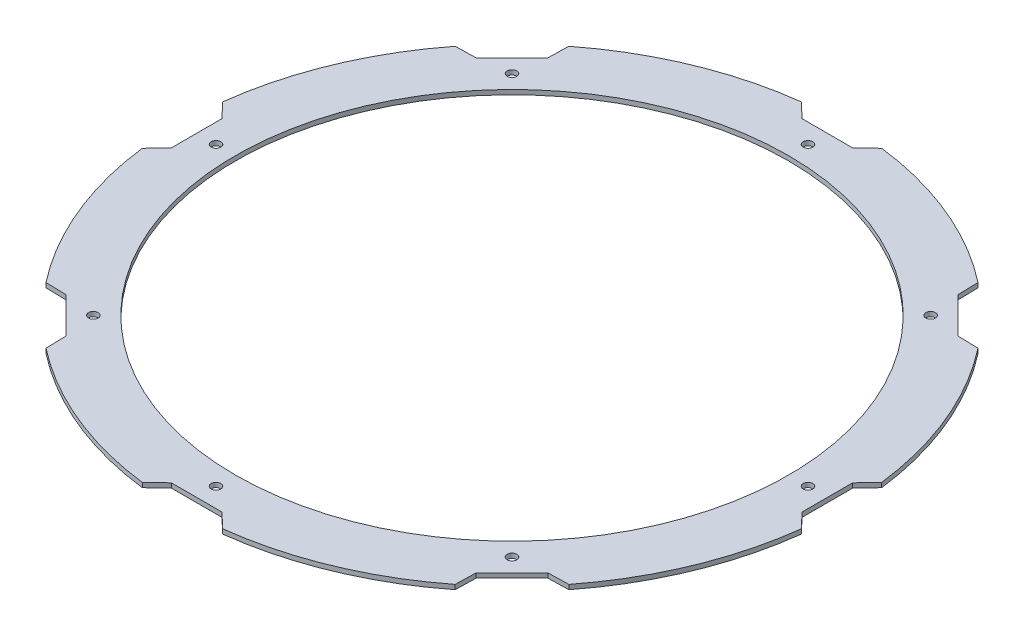
from build123d import *

# Parameters (mm, degrees)
SKETCH1_R           = 3.302
SKETCH1_R_2         = 190.5
BOSS_EXTRUDE1_DEPTH = 3.175
CHAMFER1_DEPTH      = 3.175


with BuildPart() as part:
    # Sketch1 → Boss-Extrude1 (new body)
    with BuildSketch(Plane(origin=(0, 0, 0), x_dir=(1, 0, 0), z_dir=(0, 1, 0))):
        with BuildLine():
            Line((228.003026076, -16.51), (217.17, -16.51))
            Line((217.17, -16.51), (217.17, 16.51))
            Line((217.17, 16.51), (228.003026076, 16.51))
            ThreePointArc((228.003026076, 16.51), (211.198861132, 87.481432639), (172.896818827, 149.548152912))
            Line((172.896818827, 149.548152912), (165.236712628, 141.888046713))
            Line((165.236712628, 141.888046713), (141.888046713, 165.236712628))
            Line((141.888046713, 165.236712628), (149.548152912, 172.896818827))
            ThreePointArc((149.548152912, 172.896818827), (87.481432639, 211.198861132), (16.51, 228.003026076))
            Line((16.51, 228.003026076), (16.51, 217.17))
            Line((16.51, 217.17), (-16.51, 217.17))
            Line((-16.51, 217.17), (-16.51, 228.003026076))
            ThreePointArc((-16.51, 228.003026076), (-87.481432639, 211.198861132), (-149.548152912, 172.896818827))
            Line((-149.548152912, 172.896818827), (-141.888046713, 165.236712628))
            Line((-141.888046713, 165.236712628), (-165.236712628, 141.888046713))
            Line((-165.236712628, 141.888046713), (-172.896818827, 149.548152912))
            ThreePointArc((-172.896818827, 149.548152912), (-211.198861132, 87.481432639), (-228.003026076, 16.51))
            Line((-228.003026076, 16.51), (-217.17, 16.51))
            Line((-217.17, 16.51), (-217.17, -16.51))
            Line((-217.17, -16.51), (-228.003026076, -16.51))
            ThreePointArc((-228.003026076, -16.51), (-211.198861132, -87.481432639), (-172.896818827, -149.548152912))
            Line((-172.896818827, -149.548152912), (-165.236712628, -141.888046713))
            Line((-165.236712628, -141.888046713), (-141.888046713, -165.236712628))
            Line((-141.888046713, -165.236712628), (-149.548152912, -172.896818827))
            ThreePointArc((-149.548152912, -172.896818827), (-87.481432639, -211.198861132), (-16.51, -228.003026076))
            Line((-16.51, -228.003026076), (-16.51, -217.17))
            Line((-16.51, -217.17), (16.51, -217.17))
            Line((16.51, -217.17), (16.51, -228.003026076))
            ThreePointArc((16.51, -228.003026076), (87.481432639, -211.198861132), (149.548152912, -172.896818827))
            Line((149.548152912, -172.896818827), (141.888046713, -165.236712628))
            Line((141.888046713, -165.236712628), (165.236712628, -141.888046713))
            Line((165.236712628, -141.888046713), (172.896818827, -149.548152912))
            ThreePointArc((172.896818827, -149.548152912), (211.198861132, -87.481432639), (228.003026076, -16.51))
        make_face()
        with Locations(Location((-144.133110743, -144.133110743, 0), (0, 0, 270))):
            Circle(SKETCH1_R, mode=Mode.SUBTRACT)
        with Locations(Location((0, -203.835, 0), (0, 0, 270))):
            Circle(SKETCH1_R, mode=Mode.SUBTRACT)
        with Locations(Location((144.133110743, -144.133110743, 0), (0, 0, 270))):
            Circle(SKETCH1_R, mode=Mode.SUBTRACT)
        with Locations(Location((203.835, 0, 0), (0, 0, 270))):
            Circle(SKETCH1_R, mode=Mode.SUBTRACT)
        with Locations(Location((-203.835, 0, 0), (0, 0, 270))):
            Circle(SKETCH1_R, mode=Mode.SUBTRACT)
        with Locations(Location((-144.133110743, 144.133110743, 0), (0, 0, 270))):
            Circle(SKETCH1_R, mode=Mode.SUBTRACT)
        with Locations(Location((0, 0, 0), (0, 0, 270))):
            Circle(SKETCH1_R_2, mode=Mode.SUBTRACT)
        with Locations(Location((0, 203.835, 0), (0, 0, 270))):
            Circle(SKETCH1_R, mode=Mode.SUBTRACT)
        with Locations(Location((144.133110743, 144.133110743, 0), (0, 0, 270))):
            Circle(SKETCH1_R, mode=Mode.SUBTRACT)
    extrude(amount=BOSS_EXTRUDE1_DEPTH)

    # Chamfer1: read off the stored shape, not the designer's step
    # Chamfer1 outline → Chamfer1 (cut)
    with BuildSketch(Plane(origin=(0, 0, 0), x_dir=(1, 0, 0), z_dir=(0, 1, 0))):
        with BuildLine():
            ThreePointArc((228.003026076, 16.51), (227.528537531, 22.1071167), (226.916669439, 27.690885335))
            Line((226.916669439, 27.690885335), (217.17, 17.417305498))
            Line((217.17, 17.417305498), (217.17, 16.51))
            Line((217.17, 16.51), (228.003026076, 16.51))
        make_face()
        with BuildLine():
            Line((165.878274498, 141.246484842), (180.034728522, 140.873902927))
            ThreePointArc((180.034728522, 140.873902927), (176.519063933, 145.254879671), (172.896818827, 149.548152912))
            Line((172.896818827, 149.548152912), (165.236712628, 141.888046713))
            Line((165.236712628, 141.888046713), (165.878274498, 141.246484842))
        make_face()
        with BuildLine():
            Line((228.003026076, -16.51), (217.17, -16.51))
            Line((217.17, -16.51), (217.17, -17.417305498))
            Line((217.17, -17.417305498), (226.916669439, -27.690885335))
            ThreePointArc((226.916669439, -27.690885335), (227.528537531, -22.1071167), (228.003026076, -16.51))
        make_face()
        with BuildLine():
            Line((141.246484842, 165.878274498), (141.888046712, 165.236712627))
            Line((141.888046712, 165.236712627), (149.548152912, 172.896818827))
            ThreePointArc((149.548152912, 172.896818827), (145.254879671, 176.519063933), (140.873902927, 180.034728522))
            Line((140.873902927, 180.034728522), (141.246484842, 165.878274498))
        make_face()
        with BuildLine():
            ThreePointArc((172.896818827, -149.548152912), (176.519063933, -145.254879671), (180.034728522, -140.873902927))
            Line((180.034728522, -140.873902927), (165.878274498, -141.246484842))
            Line((165.878274498, -141.246484842), (165.236712627, -141.888046712))
            Line((165.236712627, -141.888046712), (172.896818827, -149.548152912))
        make_face()
        with BuildLine():
            Line((17.417305498, 217.17), (27.690885335, 226.916669439))
            ThreePointArc((27.690885335, 226.916669439), (22.1071167, 227.528537531), (16.51, 228.003026076))
            Line((16.51, 228.003026076), (16.51, 217.17))
            Line((16.51, 217.17), (17.417305498, 217.17))
        make_face()
        with BuildLine():
            Line((149.548152912, -172.896818827), (141.888046713, -165.236712628))
            Line((141.888046713, -165.236712628), (141.246484842, -165.878274498))
            Line((141.246484842, -165.878274498), (140.873902927, -180.034728522))
            ThreePointArc((140.873902927, -180.034728522), (145.254879671, -176.519063933), (149.548152912, -172.896818827))
        make_face()
        with BuildLine():
            Line((-17.417305498, 217.17), (-16.51, 217.17))
            Line((-16.51, 217.17), (-16.51, 228.003026076))
            ThreePointArc((-16.51, 228.003026076), (-22.1071167, 227.528537531), (-27.690885335, 226.916669439))
            Line((-27.690885335, 226.916669439), (-17.417305498, 217.17))
        make_face()
        with BuildLine():
            ThreePointArc((16.51, -228.003026076), (22.1071167, -227.528537531), (27.690885335, -226.916669439))
            Line((27.690885335, -226.916669439), (17.417305498, -217.17))
            Line((17.417305498, -217.17), (16.51, -217.17))
            Line((16.51, -217.17), (16.51, -228.003026076))
        make_face()
        with BuildLine():
            Line((-141.246484842, 165.878274498), (-140.873902927, 180.034728522))
            ThreePointArc((-140.873902927, 180.034728522), (-145.254879671, 176.519063933), (-149.548152912, 172.896818827))
            Line((-149.548152912, 172.896818827), (-141.888046713, 165.236712628))
            Line((-141.888046713, 165.236712628), (-141.246484842, 165.878274498))
        make_face()
        with BuildLine():
            Line((-16.51, -228.003026076), (-16.51, -217.17))
            Line((-16.51, -217.17), (-17.417305498, -217.17))
            Line((-17.417305498, -217.17), (-27.690885335, -226.916669439))
            ThreePointArc((-27.690885335, -226.916669439), (-22.1071167, -227.528537531), (-16.51, -228.003026076))
        make_face()
        with BuildLine():
            Line((-165.878274498, 141.246484842), (-165.236712627, 141.888046712))
            Line((-165.236712627, 141.888046712), (-172.896818827, 149.548152912))
            ThreePointArc((-172.896818827, 149.548152912), (-176.519063933, 145.254879671), (-180.034728522, 140.873902927))
            Line((-180.034728522, 140.873902927), (-165.878274498, 141.246484842))
        make_face()
        with BuildLine():
            ThreePointArc((-149.548152912, -172.896818827), (-145.254879671, -176.519063933), (-140.873902927, -180.034728522))
            Line((-140.873902927, -180.034728522), (-141.246484842, -165.878274498))
            Line((-141.246484842, -165.878274498), (-141.888046712, -165.236712627))
            Line((-141.888046712, -165.236712627), (-149.548152912, -172.896818827))
        make_face()
        with BuildLine():
            Line((-217.17, 17.417305498), (-226.916669439, 27.690885335))
            ThreePointArc((-226.916669439, 27.690885335), (-227.528537531, 22.1071167), (-228.003026076, 16.51))
            Line((-228.003026076, 16.51), (-217.17, 16.51))
            Line((-217.17, 16.51), (-217.17, 17.417305498))
        make_face()
        with BuildLine():
            Line((-172.896818827, -149.548152912), (-165.236712628, -141.888046713))
            Line((-165.236712628, -141.888046713), (-165.878274498, -141.246484842))
            Line((-165.878274498, -141.246484842), (-180.034728522, -140.873902927))
            ThreePointArc((-180.034728522, -140.873902927), (-176.519063933, -145.254879671), (-172.896818827, -149.548152912))
        make_face()
        with BuildLine():
            Line((-217.17, -17.417305498), (-217.17, -16.51))
            Line((-217.17, -16.51), (-228.003026076, -16.51))
            ThreePointArc((-228.003026076, -16.51), (-227.528537531, -22.1071167), (-226.916669439, -27.690885335))
            Line((-226.916669439, -27.690885335), (-217.17, -17.417305498))
        make_face()
    extrude(amount=CHAMFER1_DEPTH, mode=Mode.SUBTRACT)


solid = part.part
